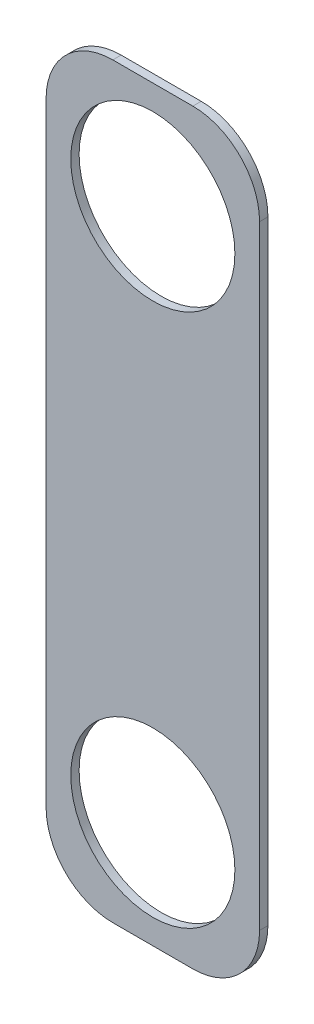
from build123d import *

# Parameters (mm, degrees)
SKETCH1_R           = 15.621
BOSS_EXTRUDE1_DEPTH = 1.5875


with BuildPart() as part:
    # Sketch1 → Boss-Extrude1 (new body)
    with BuildSketch(Plane.XY):
        with BuildLine():
            Line((-7.62, 20.32), (7.62, 20.32))
            ThreePointArc((7.62, 20.32), (16.600256121, 16.600256121), (20.32, 7.62))
            Line((20.32, 7.62), (20.32, -109.22))
            ThreePointArc((20.32, -109.22), (16.600256121, -118.200256121), (7.62, -121.92))
            Line((7.62, -121.92), (-7.62, -121.92))
            ThreePointArc((-7.62, -121.92), (-16.600256121, -118.200256121), (-20.32, -109.22))
            Line((-20.32, -109.22), (-20.32, 7.62))
            ThreePointArc((-20.32, 7.62), (-16.600256121, 16.600256121), (-7.62, 20.32))
        make_face()
        Circle(SKETCH1_R, mode=Mode.SUBTRACT)
        with Locations((0, -101.6)):
            Circle(SKETCH1_R, mode=Mode.SUBTRACT)
    extrude(amount=BOSS_EXTRUDE1_DEPTH)


solid = part.part
